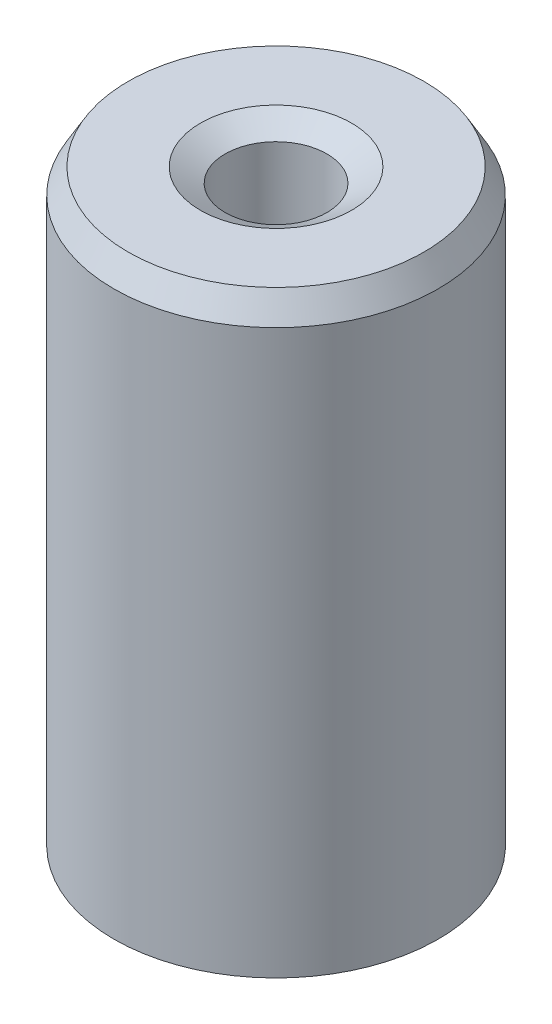
from build123d import *
from OCP.BRepFilletAPI import BRepFilletAPI_MakeChamfer

# Parameters (mm, degrees)
SKETCH1_R           = 7.5
BOSS_EXTRUDE1_DEPTH = 27.851224165
SKETCH2_R           = 2.352314515
CUT_EXTRUDE1_DEPTH  = 30.802528207
CHAMFER1_SIZE       = 1.14392953
CHAMFER1_SIZE2      = 0.660448022


with BuildPart() as part:
    # Sketch1 → Boss-Extrude1 (new body)
    with BuildSketch(Plane(origin=(0, 0, 0), x_dir=(1, 0, 0), z_dir=(0, 1, 0))):
        Circle(SKETCH1_R)
    extrude(amount=BOSS_EXTRUDE1_DEPTH)

    # Sketch2 → Cut-Extrude1 (cut, through all)
    with BuildSketch(Plane(origin=(0, 0, 0), x_dir=(1, 0, 0), z_dir=(0, 1, 0))):
        Circle(SKETCH2_R)
    extrude(amount=CUT_EXTRUDE1_DEPTH, mode=Mode.SUBTRACT)

    # Chamfer1: one chamfer whose edges measure the first distance from different faces: ONE call of the kernel's chamfer builder (chamfer() names one face for all edges)
    chamfer1_edges_1 = [part.edges().sort_by_distance(p)[0] for p in [
        (-2.352314515, 27.851224165, 0),
    ]]
    chamfer1_side_1 = [part.faces().sort_by_distance(p)[0] for p in [
        (-7.287867966, 27.851224165, 0),
    ]]
    chamfer1_edges_2 = [part.edges().sort_by_distance(p)[0] for p in [
        (-2.352314515, 0, 0),
    ]]
    chamfer1_side_2 = [part.faces().sort_by_distance(p)[0] for p in [
        (-2.352314515, 13.925612083, 0),
    ]]
    chamfer1_edges_3 = [part.edges().sort_by_distance(p)[0] for p in [
        (-7.5, 0, 0),
    ]]
    chamfer1_side_3 = [part.faces().sort_by_distance(p)[0] for p in [
        (-7.287867966, 0, 0),
    ]]
    chamfer1_edges_4 = [part.edges().sort_by_distance(p)[0] for p in [
        (-7.5, 27.851224165, 0),
    ]]
    chamfer1_side_4 = [part.faces().sort_by_distance(p)[0] for p in [
        (-7.5, 13.925612083, 0),
    ]]
    chamfer1 = BRepFilletAPI_MakeChamfer(part.part.solid().wrapped)
    for e in chamfer1_edges_1:
        chamfer1.Add(CHAMFER1_SIZE, CHAMFER1_SIZE2, e.wrapped, chamfer1_side_1[0].wrapped)  # the first distance lies on this face
    for e in chamfer1_edges_2:
        chamfer1.Add(CHAMFER1_SIZE, CHAMFER1_SIZE2, e.wrapped, chamfer1_side_2[0].wrapped)  # the first distance lies on this face
    for e in chamfer1_edges_3:
        chamfer1.Add(CHAMFER1_SIZE, CHAMFER1_SIZE2, e.wrapped, chamfer1_side_3[0].wrapped)  # the first distance lies on this face
    for e in chamfer1_edges_4:
        chamfer1.Add(CHAMFER1_SIZE, CHAMFER1_SIZE2, e.wrapped, chamfer1_side_4[0].wrapped)  # the first distance lies on this face
    add(Compound.cast(chamfer1.Shape()), mode=Mode.REPLACE)


solid = part.part
